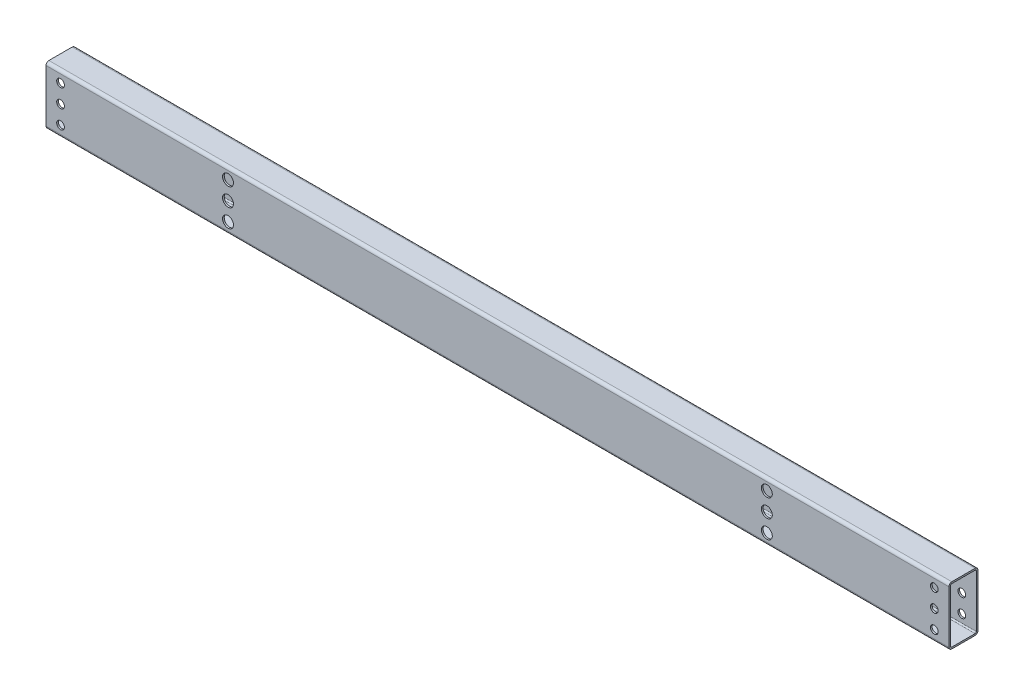
from build123d import *

# Parameters (mm, degrees)
EXTRUDE_THIN1_DEPTH          = 393.7
F_1_4_CLEARANCE_HOLE1_D      = 6.7564
F_3_8_0_375_DIAMETER_HOLE1_D = 9.525
CUT_EXTRUDE1_DEPTH           = 9.525


with BuildPart() as part:
    # Sketch1 → Extrude-Thin1 (new, symmetric)
    with BuildSketch(Plane(origin=(0, 0, 0), x_dir=(0, 0, -1), z_dir=(1, 0, 0))):
        with BuildLine():
            Line((-10.16, 25.4), (10.16, 25.4))
            ThreePointArc((10.16, 25.4), (11.956051224, 24.656051224), (12.7, 22.86))
            Line((12.7, 22.86), (12.7, -22.86))
            ThreePointArc((12.7, -22.86), (11.956051224, -24.656051224), (10.16, -25.4))
            Line((10.16, -25.4), (-10.16, -25.4))
            ThreePointArc((-10.16, -25.4), (-11.956051224, -24.656051224), (-12.7, -22.86))
            Line((-12.7, -22.86), (-12.7, 22.86))
            ThreePointArc((-12.7, 22.86), (-11.956051224, 24.656051224), (-10.16, 25.4))
        make_face()
        with BuildLine():
            Line((-10.16, 23.9522), (10.16, 23.9522))
            ThreePointArc((10.16, 23.9522), (10.932302026, 23.632302026), (11.2522, 22.86))
            Line((11.2522, 22.86), (11.2522, -22.86))
            ThreePointArc((11.2522, -22.86), (10.932302026, -23.632302026), (10.16, -23.9522))
            Line((10.16, -23.9522), (-10.16, -23.9522))
            ThreePointArc((-10.16, -23.9522), (-10.932302026, -23.632302026), (-11.2522, -22.86))
            Line((-11.2522, -22.86), (-11.2522, 22.86))
            ThreePointArc((-11.2522, 22.86), (-10.932302026, 23.632302026), (-10.16, 23.9522))
        make_face(mode=Mode.SUBTRACT)
    extrude(amount=EXTRUDE_THIN1_DEPTH, both=True)

    # 1/4 Clearance Hole1 (through all)
    with Locations(Plane(origin=(0, 0, -12.7), x_dir=(-1, 0, 0), z_dir=(0, 0, -1))):
        with Locations((-381, 15.875), (-381, -15.875), (-381, 0), (381, -15.875), (381, 0), (381, 15.875)):
            Hole(F_1_4_CLEARANCE_HOLE1_D / 2)

    # 3/8 (0.375) Diameter Hole1 (through all)
    with Locations(Plane(origin=(0, 0, -12.7), x_dir=(-1, 0, 0), z_dir=(0, 0, -1))):
        with Locations((-234.95, 15.875), (-234.95, 0), (-234.95, -15.875), (234.95, -15.875), (234.95, 0), (234.95, 15.875)):
            Hole(F_3_8_0_375_DIAMETER_HOLE1_D / 2)

    # Sketch6 → Cut-Extrude1 (cut)
    with BuildSketch(Plane(origin=(0, 0, -12.7), x_dir=(-1, 0, 0), z_dir=(0, 0, -1))):
        with BuildLine():
            Line((-120.65, -25.4), (-107.95, -25.4))
            Line((-107.95, -25.4), (-107.95, 15.875))
            ThreePointArc((-107.95, 15.875), (-108.87993597, 18.12006403), (-111.125, 19.05))
            Line((-111.125, 19.05), (-117.475, 19.05))
            ThreePointArc((-117.475, 19.05), (-119.72006403, 18.12006403), (-120.65, 15.875))
            Line((-120.65, 15.875), (-120.65, -25.4))
        make_face()
        with BuildLine():
            Line((-44.45, -25.4), (-31.75, -25.4))
            Line((-31.75, -25.4), (-31.75, 15.875))
            ThreePointArc((-31.75, 15.875), (-32.67993597, 18.12006403), (-34.925, 19.05))
            Line((-34.925, 19.05), (-41.275, 19.05))
            ThreePointArc((-41.275, 19.05), (-43.52006403, 18.12006403), (-44.45, 15.875))
            Line((-44.45, 15.875), (-44.45, -25.4))
        make_face()
        with BuildLine():
            Line((31.75, -25.4), (44.45, -25.4))
            Line((44.45, -25.4), (44.45, 15.875))
            ThreePointArc((44.45, 15.875), (43.52006403, 18.12006403), (41.275, 19.05))
            Line((41.275, 19.05), (34.925, 19.05))
            ThreePointArc((34.925, 19.05), (32.67993597, 18.12006403), (31.75, 15.875))
            Line((31.75, 15.875), (31.75, -25.4))
        make_face()
        with BuildLine():
            Line((107.95, -25.4), (120.65, -25.4))
            Line((120.65, -25.4), (120.65, 15.875))
            ThreePointArc((120.65, 15.875), (119.72006403, 18.12006403), (117.475, 19.05))
            Line((117.475, 19.05), (111.125, 19.05))
            ThreePointArc((111.125, 19.05), (108.87993597, 18.12006403), (107.95, 15.875))
            Line((107.95, 15.875), (107.95, -25.4))
        make_face()
    extrude(amount=-CUT_EXTRUDE1_DEPTH, mode=Mode.SUBTRACT)


solid = part.part
